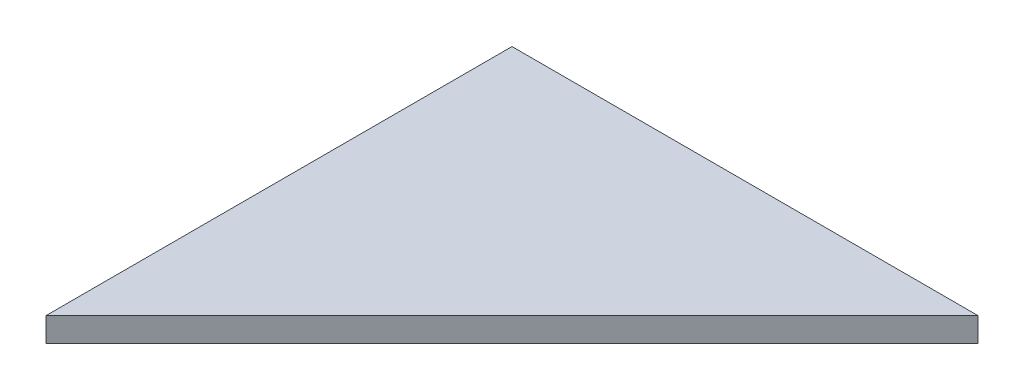
from build123d import *

# Parameters (mm, degrees)
BOSS_EXTRUDE1_DEPTH = 1.5


with BuildPart() as part:
    # Sketch1 → Boss-Extrude1 (new, symmetric)
    with BuildSketch(Plane(origin=(0, -113.704878, 0), x_dir=(-1, 0, 0), z_dir=(0, -1, 0))):
        Polygon((-107.572775552, -49.638102576), (-49.638102576, -107.572775552), (-49.638102576, -49.638102576), align=None)
    extrude(amount=BOSS_EXTRUDE1_DEPTH, both=True)


solid = part.part
